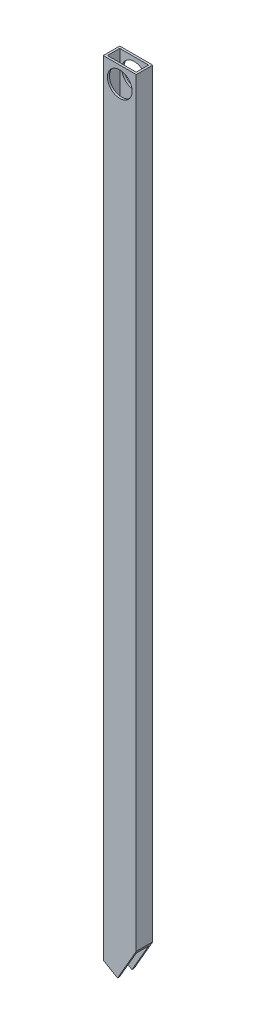
from build123d import *

# Parameters (mm, degrees)
SKETCH1_W           = 50.8
SKETCH1_H           = 25.4
SKETCH1_W_2         = 44.45
SKETCH1_H_2         = 19.05
BOSS_EXTRUDE1_DEPTH = 1219.2
SKETCH2_R           = 19.05
CUT_EXTRUDE1_DEPTH  = 1220.72905188


with BuildPart() as part:
    # Sketch1 → Boss-Extrude1 (new body)
    with BuildSketch(Plane(origin=(0, 0, 0), x_dir=(1, 0, 0), z_dir=(0, 1, 0))):
        Rectangle(SKETCH1_W, SKETCH1_H)
        Rectangle(SKETCH1_W_2, SKETCH1_H_2, mode=Mode.SUBTRACT)
    extrude(amount=BOSS_EXTRUDE1_DEPTH)

    # Sketch2 → Cut-Extrude1 (cut, through all)
    with BuildSketch(Plane.XY.offset(12.7)):
        Polygon((25.4, 49.888181024), (-3.402954744, 0), (25.4, 0), align=None)
        Polygon((-25.4, 12.7), (-25.4, 0), (-3.402954744, 0), align=None)
        with Locations((0, 1193.8)):
            Circle(SKETCH2_R)
    extrude(amount=-CUT_EXTRUDE1_DEPTH, mode=Mode.SUBTRACT)


solid = part.part
